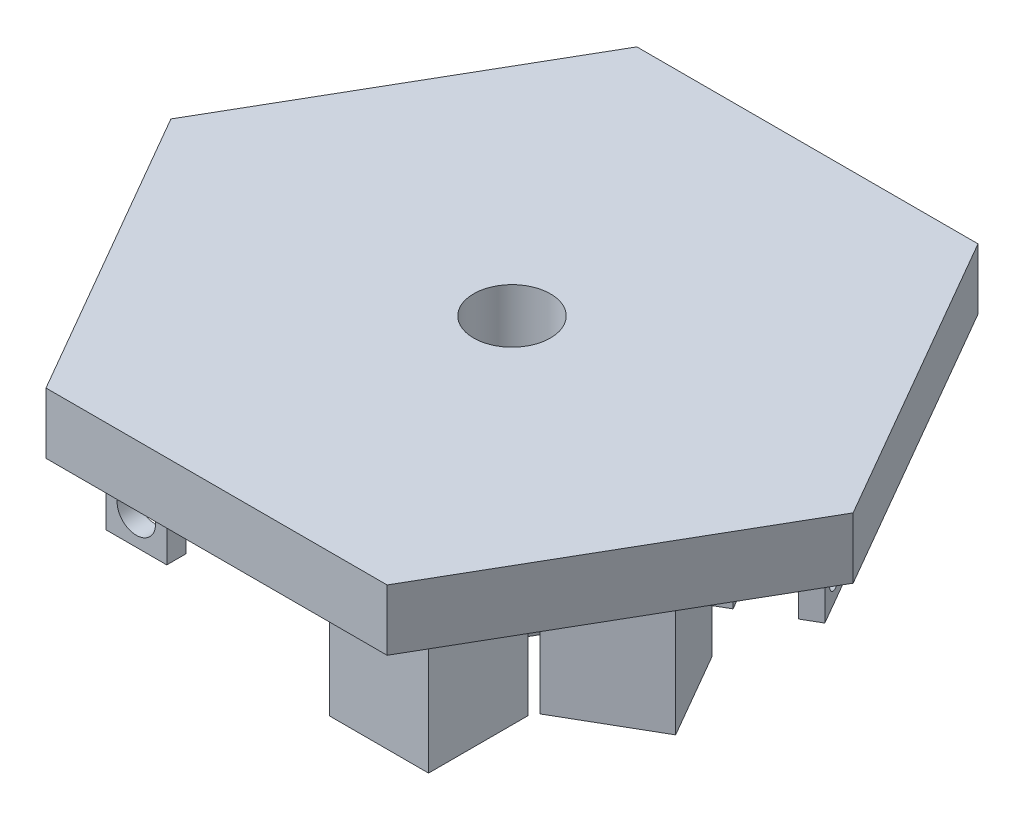
from build123d import *

# Parameters (mm, degrees)
BOSS_EXTRUDE1_DEPTH = 6.35
SKETCH6_R           = 4
CUT_EXTRUDE1_DEPTH  = 48.468108241
SKETCH2_W           = 6.35
SKETCH2_H           = 6.35
BOSS_EXTRUDE2_DEPTH = 25.4
SKETCH7_W           = 6.35
SKETCH7_H           = 2
BOSS_EXTRUDE3_DEPTH = 6.35
SKETCH9_R           = 2
CUT_EXTRUDE2_DEPTH  = 9.588
CIRPATTERN1_COUNT   = 3


with BuildPart() as part:
    # Sketch1 → Boss-Extrude1 (new body)
    with BuildSketch(Plane(origin=(0, 0, 0), x_dir=(1, 0, 0), z_dir=(0, 1, 0))):
        Polygon((17.78, -30.795863359), (35.56, 0), (17.78, 30.795863359), (-17.78, 30.795863359), (-35.56, 0), (-17.78, -30.795863359), align=None)
    extrude(amount=BOSS_EXTRUDE1_DEPTH)

    # Sketch6 → Cut-Extrude1 (cut, through all)
    with BuildSketch(Plane(origin=(0, 6.35, 0), x_dir=(1, 0, 0), z_dir=(0, 1, 0))):
        Circle(SKETCH6_R)
    extrude(amount=-CUT_EXTRUDE1_DEPTH, mode=Mode.SUBTRACT)

    # Sketch2 → Boss-Extrude2 (add)
    # profile 1 of 3: a face of its own
    with BuildSketch(Plane.XZ):
        with BuildLine():
            Line((-5.175, 13.874), (-5.175, 3.524))
            Line((-5.175, 3.524), (-1.892465059, 3.524))
            ThreePointArc((-1.892465059, 3.524), (0, 4), (1.892465059, 3.524))
            Line((1.892465059, 3.524), (5.175, 3.524))
            Line((5.175, 3.524), (5.175, 13.874))
            Line((5.175, 13.874), (-5.175, 13.874))
        make_face()
        with Locations((0, 8.699)):
            Rectangle(SKETCH2_W, SKETCH2_H, mode=Mode.SUBTRACT)
    # profile 2 of 3: a face of its own
    with BuildSketch(Plane.XZ):
        with BuildLine():
            Line((2.105640993, -3.400922817), (0.464373523, -6.243681465))
            Line((0.464373523, -6.243681465), (9.427736452, -11.418681465))
            Line((9.427736452, -11.418681465), (14.602736452, -2.455318535))
            Line((14.602736452, -2.455318535), (5.639373523, 2.719681465))
            Line((5.639373523, 2.719681465), (3.998106052, -0.123077183))
            ThreePointArc((3.998106052, -0.123077183), (3.464101615, -2), (2.105640993, -3.400922817))
        make_face()
        Polygon((11.870685645, -3.187369343), (6.371424331, -0.012369343), (3.196424331, -5.511630657), (8.695685645, -8.686630657), align=None, mode=Mode.SUBTRACT)
    # profile 3 of 3: a face of its own
    with BuildSketch(Plane.XZ):
        with BuildLine():
            Line((-3.998106052, -0.123077183), (-5.639373523, 2.719681465))
            Line((-5.639373523, 2.719681465), (-14.602736452, -2.455318535))
            Line((-14.602736452, -2.455318535), (-9.427736452, -11.418681465))
            Line((-9.427736452, -11.418681465), (-0.464373523, -6.243681465))
            Line((-0.464373523, -6.243681465), (-2.105640993, -3.400922817))
            ThreePointArc((-2.105640993, -3.400922817), (-3.464101615, -2), (-3.998106052, -0.123077183))
        make_face()
        Polygon((-8.695685645, -8.686630657), (-3.196424331, -5.511630657), (-6.371424331, -0.012369343), (-11.870685645, -3.187369343), align=None, mode=Mode.SUBTRACT)
    extrude(amount=BOSS_EXTRUDE2_DEPTH)

    # Sketch7 → Boss-Extrude3 (add)
    with BuildSketch(Plane.XZ):
        with Locations((-11.390300372, 19.7726)):
            Rectangle(SKETCH7_W, SKETCH7_H)
        with Locations((-11.390300372, 26.7726)):
            Rectangle(SKETCH7_W, SKETCH7_H)
        Polygon((25.272249489, 2.227620136), (22.097249489, -3.271641178), (20.365198681, -2.271641178), (23.540198681, 3.227620136), align=None)
        Polygon((29.602376508, -0.272379864), (31.334427315, -1.272379864), (28.159427315, -6.771641178), (26.427376508, -5.771641178), align=None)
        Polygon((-10.706949117, -23.000220136), (-13.881949117, -17.500958822), (-12.149898309, -16.500958822), (-8.974898309, -22.000220136), align=None)
        Polygon((-15.037076136, -25.500220136), (-16.769126943, -26.500220136), (-19.944126943, -21.000958822), (-18.212076136, -20.000958822), align=None)
    extrude(amount=BOSS_EXTRUDE3_DEPTH)

    # Sketch9 → Cut-Extrude2 (cut)
    with BuildSketch(Plane.XY.offset(27.7726)):
        with Locations((-11.390300372, -3.262620176)):
            Circle(SKETCH9_R)
    cut_extrude2 = extrude(amount=-CUT_EXTRUDE2_DEPTH, mode=Mode.SUBTRACT)

    # CirPattern1: Cut-Extrude2 ×3 about axis
    cirpattern1_axis = Axis((0, 0, 0), (0, 1, 0))
    for i in range(1, CIRPATTERN1_COUNT):
        add(cut_extrude2.rotate(cirpattern1_axis, i * 360 / CIRPATTERN1_COUNT), mode=Mode.SUBTRACT)


solid = part.part
